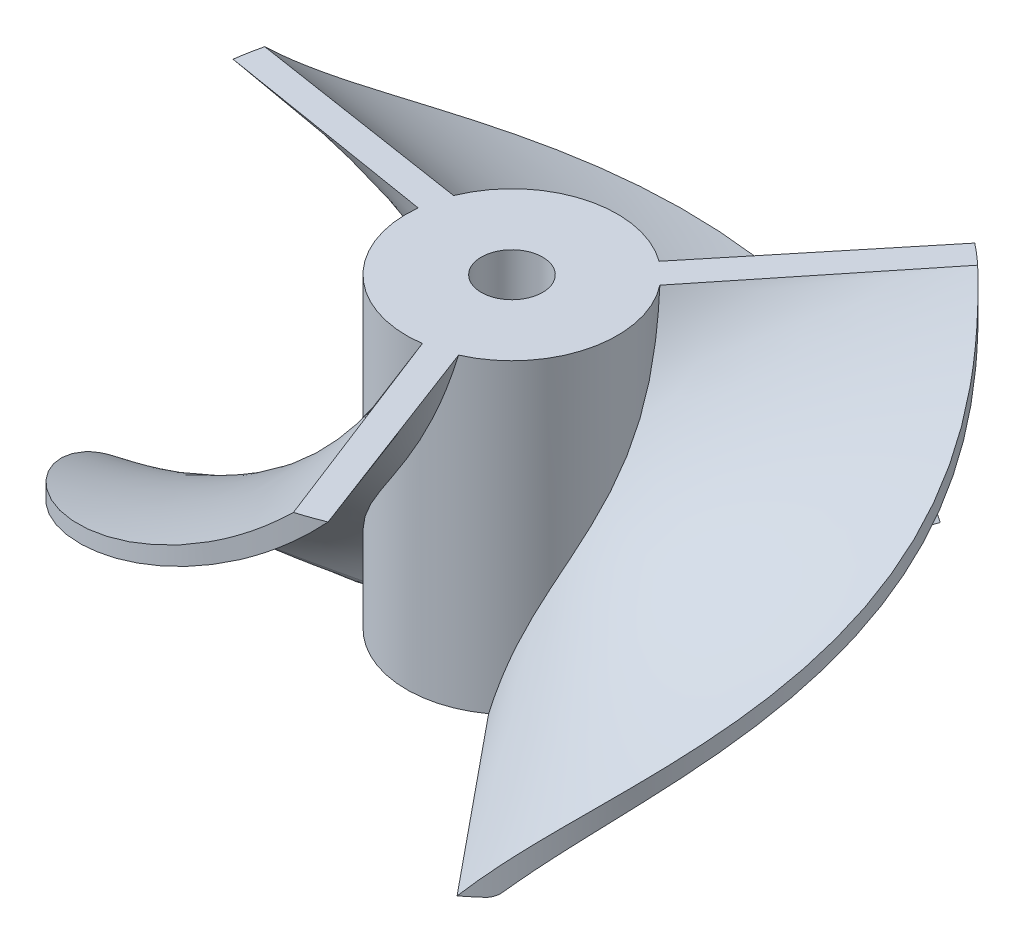
from build123d import *

# Parameters (mm, degrees)
IZIM1_R                        = 11
Y_KSEKLIK_EKSTR_ZYON1_DEPTH    = 32
RADYUS1_R                      = 2
DAIRESEL_KAPLAMA1_COUNT        = 3
RADYUS1_OF_DAIRESEL_KAPLAMA1_R = 2
IZIM5_R                        = 100
IZIM5_R_2                      = 34.4
KES_EKSTR_ZYON1_DEPTH          = 103.712063893
KES_EKSTR_ZYON2_DEPTH          = 12
KES_EKSTR_ZYON3_START          = 20
IZIM8_R                        = 3.2
KES_EKSTR_ZYON3_DEPTH          = 39.229889414
IZIM9_R                        = 1.65
KES_EKSTR_ZYON4_DEPTH          = 59.229889414


with BuildPart() as part:
    # Çizim1 → Yükseklik-Ekstrüzyon1 (new body)
    with BuildSketch(Plane(origin=(0, 0, 0), x_dir=(1, 0, 0), z_dir=(0, 1, 0))):
        Circle(IZIM1_R)
    extrude(amount=Y_KSEKLIK_EKSTR_ZYON1_DEPTH)

    # Çizim4 → Loft1 section 0
    with BuildSketch(Plane(origin=(45, 0, 0), x_dir=(0, 0, -1), z_dir=(1, 0, 0))):
        with BuildLine():
            Line((56, 32), (52, 32))
            Line((52, 32), (-56, 0))
            Line((-56, 0), (-52, 0))
            Line((-52, 0), (56, 32))
        make_face()
    # Çizim2 → Loft1 section 1
    with BuildSketch(Plane(origin=(0, 0, 0), x_dir=(0, 0, -1), z_dir=(1, 0, 0))):
        with BuildLine():
            Line((-1, 0), (4, 0))
            Line((4, 0), (1, 32))
            Line((1, 32), (-4, 32))
            Line((-4, 32), (-1, 0))
        make_face()
    loft1 = loft()

    # Radyus1
    radyus1_edges = [part.edges().sort_by_distance(p)[0] for p in [
        (26.831143181, 0, 29.389867069),
    ]]
    fillet(radyus1_edges, radius=RADYUS1_R)

    # Dairesel Kaplama1: Loft1 ×3 about axis
    dairesel_kaplama1_axis = Axis((0, 43.996888785, 0), (0, -1, 0))
    for i in range(1, DAIRESEL_KAPLAMA1_COUNT):
        add(loft1.rotate(dairesel_kaplama1_axis, i * 360 / DAIRESEL_KAPLAMA1_COUNT))

    # Radyus1 of Dairesel Kaplama1
    radyus1_of_dairesel_kaplama1_edges = [part.edges().sort_by_distance(p)[0] for p in [
        (-38.867943086, 0, 8.541518072),
        (12.036799906, 0, -37.931385142),
    ]]
    fillet(radyus1_of_dairesel_kaplama1_edges, radius=RADYUS1_OF_DAIRESEL_KAPLAMA1_R)

    # Çizim5 → Kes-Ekstrüzyon1 (cut, through all)
    with BuildSketch(Plane(origin=(0, 0, 0), x_dir=(1, 0, 0), z_dir=(0, 1, 0))):
        Circle(IZIM5_R)
        Circle(IZIM5_R_2, mode=Mode.SUBTRACT)
    extrude(amount=KES_EKSTR_ZYON1_DEPTH, mode=Mode.SUBTRACT)

    # Çizim7 → Kes-Ekstrüzyon2 (cut)
    with BuildSketch(Plane(origin=(0, 0, 0), x_dir=(1, 0, 0), z_dir=(0, 1, 0))):
        with BuildLine():
            Line((4.822084611, 1.5), (7, 1.5))
            Line((7, 1.5), (7, -1.5))
            Line((7, -1.5), (4.822084611, -1.5))
            ThreePointArc((4.822084611, -1.5), (0, -5.05), (-4.822084611, -1.5))
            Line((-4.822084611, -1.5), (-7, -1.5))
            Line((-7, -1.5), (-7, 1.5))
            Line((-7, 1.5), (-4.822084611, 1.5))
            ThreePointArc((-4.822084611, 1.5), (0, 5.05), (4.822084611, 1.5))
        make_face()
    extrude(amount=KES_EKSTR_ZYON2_DEPTH, mode=Mode.SUBTRACT)

    # Çizim8 → Kes-Ekstrüzyon3 (cut, through all)
    with BuildSketch(Plane(origin=(0, 0, 0), x_dir=(1, 0, 0), z_dir=(0, 1, 0)).offset(KES_EKSTR_ZYON3_START)):
        Circle(IZIM8_R)
    extrude(amount=KES_EKSTR_ZYON3_DEPTH, mode=Mode.SUBTRACT)

    # Çizim9 → Kes-Ekstrüzyon4 (cut, through all)
    with BuildSketch(Plane(origin=(0, 0, 0), x_dir=(1, 0, 0), z_dir=(0, 1, 0))):
        Circle(IZIM9_R)
    extrude(amount=KES_EKSTR_ZYON4_DEPTH, mode=Mode.SUBTRACT)


solid = part.part
